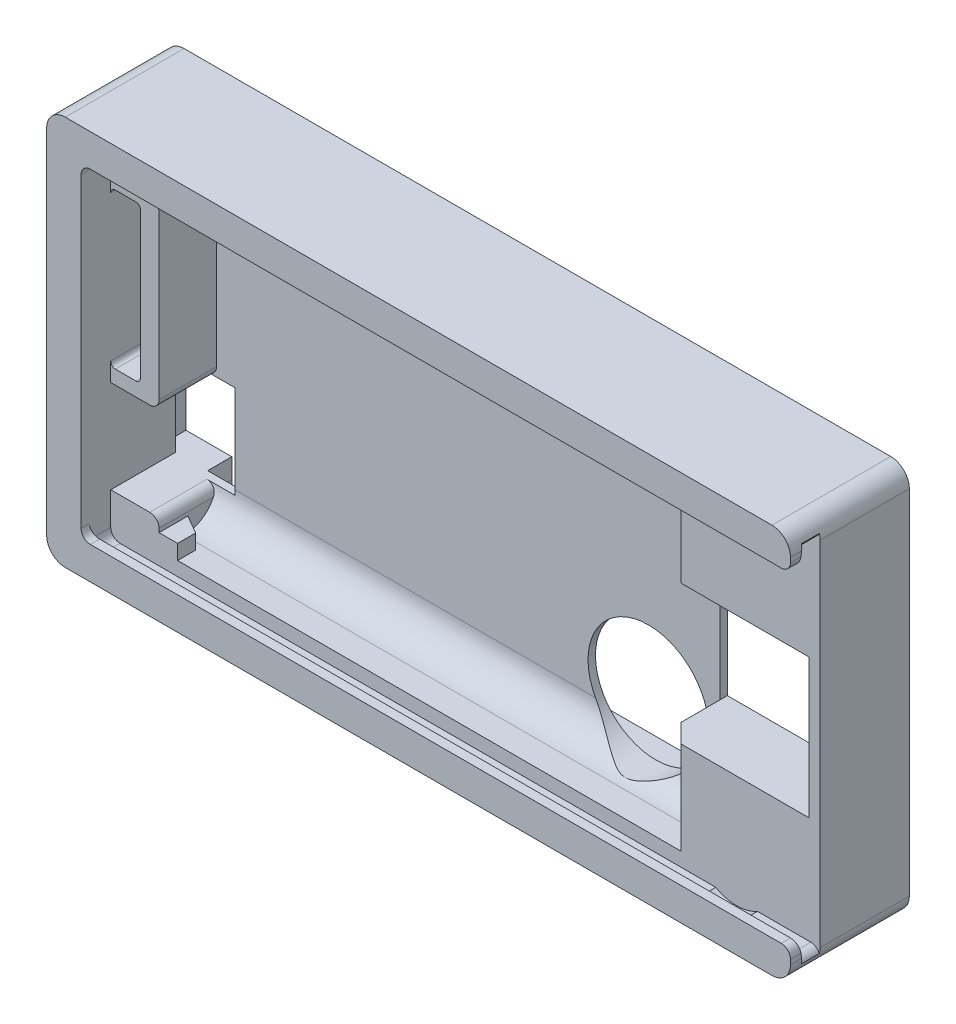
from build123d import *

# Parameters (mm, degrees)
SKETCH2_W                 = 76.4
SKETCH2_H                 = 38
BOSS_EXTRUDE1_DEPTH       = 7
CUT_BATTERY_DEPTH         = 27.1
SKETCH4_W                 = 13.8
SKETCH4_H                 = 15
CUT_FOR_FINGER_DEPTH      = 49.526384576
CHAMFER3_SIZE2            = 7
CHAMFER3_SIZE             = 2
SKETCH5_W                 = 2
SKETCH5_H                 = 3.1
BOSS_EXTRUDE2_DEPTH       = 1.6
CHAMFER1_SIZE2            = 2
CHAMFER1_SIZE             = 1.154700538
CHAMFER1_OF_MIRROR1_SIZE2 = 1.154700538
CHAMFER1_OF_MIRROR1_SIZE  = 2
SKETCH6_W                 = 7.2
SKETCH6_H                 = 10
CUT_CONNECTOR_DEPTH       = 49.526384576
BOSS_EXTRUDE3_DEPTH       = 10.2
SKETCH10_R                = 4.5
CUT_LATCH_DEPTH           = 2
BOSS_EXTRUDE4_REACH       = 83.802
FILLET3_R                 = 1
CHAMFER2_SIZE             = 2
FILLET2_R                 = 1
SKETCH12_W                = 3.2
SKETCH12_H                = 16.7
CUT_EXTRUDE6_DEPTH        = 50.343793936
FILLET1_R                 = 0.5
SKETCH13_W                = 1.7
SKETCH13_H                = 42
BOSS_EXTRUDE5_DEPTH       = 10.2
SKETCH16_R                = 1.1
CUT_EXTRUDE7_DEPTH        = 3
PCB_START                 = 2.6
SKETCH18_W                = 75.7
SKETCH18_H                = 37.5
SKETCH18_R                = 1.1
PCB_STAND_DEPTH           = 2.6
SKETCH19_W                = 1
SKETCH19_H                = 10
CUT_EXTRUDE8_DEPTH        = 2.6
F_2_0MM_DOWEL_HOLE1_D     = 2.2
F_2_0MM_DOWEL_HOLE1_DEPTH = 7.5
F_2_0MM_DOWEL_HOLE1_TIP   = 1.905255888
SKETCH22_W                = 80.1
SKETCH22_H                = 42
SKETCH22_W_2              = 75.7
SKETCH22_H_2              = 37.5
BOSS_EXTRUDE8_DEPTH       = 2.6
FILLET4_R                 = 2
FILLET5_R                 = 1
FILLET6_R                 = 1
FILLET7_R                 = 1
SKETCH23_W                = 13
SKETCH23_H                = 4.2
CUT_CAPACITOR_DEPTH       = 3
FILLET8_R                 = 2.2
MOTOR_START               = -5.886343
SKETCH24_R                = 6.5
MOTOR_DEPTH               = 3.286343


# Some blends are built 0.0001 mm under size
with BuildPart() as part:
    # Sketch2 → Boss-Extrude1 (new body)
    with BuildSketch(Plane.XY):
        with Locations((5.9, 0)):
            Rectangle(SKETCH2_W, SKETCH2_H)
    extrude(amount=BOSS_EXTRUDE1_DEPTH)

    # Sketch3 → Cut-Battery (cut, symmetric)
    with BuildSketch(Plane(origin=(0, 0, 0), x_dir=(0, 0, -1), z_dir=(1, 0, 0))):
        with BuildLine():
            Line((-7.8, 17.5), (-4.3, 17.5))
            ThreePointArc((-4.3, 17.5), (-1.825126266, 16.474873734), (-0.8, 14))
            Line((-0.8, 14), (-0.8, -14))
            ThreePointArc((-0.8, -14), (-1.825126266, -16.474873734), (-4.3, -17.5))
            Line((-4.3, -17.5), (-7.8, -17.5))
            Line((-7.8, -17.5), (-7.8, 17.5))
        make_face()
    extrude(amount=CUT_BATTERY_DEPTH, both=True, mode=Mode.SUBTRACT)

    # Sketch4 → Cut for finger (cut, through all)
    with BuildSketch(Plane.XY.offset(7)):
        with Locations((34, 0)):
            Rectangle(SKETCH4_W, SKETCH4_H)
    extrude(amount=-CUT_FOR_FINGER_DEPTH, mode=Mode.SUBTRACT)

    # Chamfer3
    chamfer3_edges = [part.edges().sort_by_distance(p)[0] for p in [
        (40.9, 0, 7),
    ]]
    chamfer3_side = [part.faces().sort_by_distance(p)[0] for p in [
        (40.94, 0, 7),
    ]]
    chamfer(chamfer3_edges, length=CHAMFER3_SIZE - 0.0001, length2=CHAMFER3_SIZE2 - 0.0001, reference=chamfer3_side[0])  # a hair under: the kernel refuses the full size

    # Sketch5 → Boss-Extrude2 (add)
    with BuildSketch(Plane.XZ.offset(-17.5)):
        with Locations((-26.1, 5.45)):
            Rectangle(SKETCH5_W, SKETCH5_H)
    boss_extrude2 = extrude(amount=BOSS_EXTRUDE2_DEPTH)

    # Chamfer1
    chamfer1_edges = [part.edges().sort_by_distance(p)[0] for p in [
        (-25.1, 16.688533865, 3.9),
    ]]
    chamfer1_side = [part.faces().sort_by_distance(p)[0] for p in [
        (-25.1, 16.688533865, 3.923094011),
    ]]
    chamfer(chamfer1_edges, length=CHAMFER1_SIZE - 0.0001, length2=CHAMFER1_SIZE2 - 0.0001, reference=chamfer1_side[0])  # a hair under: the kernel refuses the full size

    # Mirror1: Boss-Extrude2 across plane
    add(boss_extrude2.mirror(Plane.ZX))

    # Chamfer1 of Mirror1
    chamfer1_of_mirror1_edges = [part.edges().sort_by_distance(p)[0] for p in [
        (-25.1, -16.688533865, 3.9),
    ]]
    chamfer1_of_mirror1_side = [part.faces().sort_by_distance(p)[0] for p in [
        (-25.123094011, -16.688533865, 3.9),
    ]]
    chamfer(chamfer1_of_mirror1_edges, length=CHAMFER1_OF_MIRROR1_SIZE - 0.0001, length2=CHAMFER1_OF_MIRROR1_SIZE2 - 0.0001, reference=chamfer1_of_mirror1_side[0])  # a hair under: the kernel refuses the full size

    # Sketch6 → Cut-Connector (cut, through all)
    with BuildSketch(Plane.XY.offset(7)):
        with Locations((-28.7, -9.5)):
            Rectangle(SKETCH6_W, SKETCH6_H)
    extrude(amount=-CUT_CONNECTOR_DEPTH, mode=Mode.SUBTRACT)

    # Sketch9 → Boss-Extrude3 (add)
    with BuildSketch(Plane.XY):
        Polygon((44.1, -19), (-32.3, -19), (-32.3, 19), (44.1, 19), (44.1, 21), (-34.3, 21), (-34.3, -21), (44.1, -21), align=None)
    extrude(amount=BOSS_EXTRUDE3_DEPTH)

    # Sketch10 → Cut-Latch (cut)
    with BuildSketch(Plane.XY.offset(7)):
        with Locations((35.1, 15.1)):
            Circle(SKETCH10_R)
        with Locations((35.1, -15.1)):
            Circle(SKETCH10_R)
    extrude(amount=CUT_LATCH_DEPTH, mode=Mode.SUBTRACT)

    # Boss-Extrude4: up to this face of the body (flat: up to its plane)
    boss_extrude4_end = Plane(part.part.faces().sort_by_distance((-32.3, -16.75, 7.393451395))[0])
    # Sketch11 → Boss-Extrude4 (add, up to the picked face)
    with BuildSketch(Plane(origin=(44.1, 0, 0), x_dir=(0, 0, -1), z_dir=(1, 0, 0)), mode=Mode.PRIVATE) as boss_extrude4_sk1:
        Polygon((-10.2, 19), (-9, 19), (-9.2, 17.5), (-10.2, 17.5), align=None)
    boss_extrude4_tool1 = split(extrude(boss_extrude4_sk1.sketch, amount=-BOSS_EXTRUDE4_REACH, mode=Mode.PRIVATE), bisect_by=boss_extrude4_end, keep=Keep.BOTH, mode=Mode.PRIVATE)
    # Sketch11 → Boss-Extrude4 (add, up to the picked face)
    with BuildSketch(Plane(origin=(44.1, 0, 0), x_dir=(0, 0, -1), z_dir=(1, 0, 0)), mode=Mode.PRIVATE) as boss_extrude4_sk2:
        Polygon((-9.2, -17.5), (-10.2, -17.5), (-10.2, -19), (-9, -19), align=None)
    boss_extrude4_tool2 = split(extrude(boss_extrude4_sk2.sketch, amount=-BOSS_EXTRUDE4_REACH, mode=Mode.PRIVATE), bisect_by=boss_extrude4_end, keep=Keep.BOTH, mode=Mode.PRIVATE)
    add(boss_extrude4_tool1.solids().sort_by(Axis((44.1, 18.272727, 9.648485), (-1, 0, 0)))[0])
    add(boss_extrude4_tool2.solids().sort_by(Axis((44.1, -18.272727, 9.648485), (-1, 0, 0)))[0])

    # Fillet3
    fillet3_edges = [part.edges().sort_by_distance(p)[0] for p in [
        (44.1, 19, 8),
        (44.1, -19, 8),
    ]]
    fillet(fillet3_edges, radius=FILLET3_R)

    # Chamfer2
    chamfer2_edges = [part.edges().sort_by_distance(p)[0] for p in [
        (27.1, 12.5, 7),
        (27.1, -12.5, 7),
    ]]
    chamfer(chamfer2_edges, length=CHAMFER2_SIZE)

    # Fillet2
    fillet2_edges = [part.edges().sort_by_distance(p)[0] for p in [
        (-27.1, -4.5, 3.9),
        (-27.1, -14.5, 3.917949192),
    ]]
    fillet(fillet2_edges, radius=FILLET2_R)

    # Sketch12 → Cut-Extrude6 (cut, through all)
    with BuildSketch(Plane.XY.offset(7)):
        with Locations((-30.7, 5.35)):
            Rectangle(SKETCH12_W, SKETCH12_H)
    extrude(amount=-CUT_EXTRUDE6_DEPTH, mode=Mode.SUBTRACT)

    # Fillet1
    fillet1_edges = [part.edges().sort_by_distance(p)[0] for p in [
        (-32.3, -3, 3.5),
        (-32.3, 13.7, 3.5),
        (-29.1, 13.7, 3.5),
        (-29.1, -3, 3.5),
    ]]
    fillet(fillet1_edges, radius=FILLET1_R)

    # Sketch13 → Boss-Extrude5 (add)
    with BuildSketch(Plane(origin=(0, 0, 0), x_dir=(-1, 0, 0), z_dir=(0, 0, -1))):
        with Locations((35.15, 0)):
            Rectangle(SKETCH13_W, SKETCH13_H)
    extrude(amount=-BOSS_EXTRUDE5_DEPTH)

    # Sketch16 → Cut-Extrude7 (cut)
    with BuildSketch(Plane(origin=(0, 0, 0), x_dir=(-1, 0, 0), z_dir=(0, 0, -1))):
        with Locations((-39.55, 16.4)):
            Circle(SKETCH16_R)
        with Locations((31.45, 16.4)):
            Circle(SKETCH16_R)
        with Locations((31.45, -16.4)):
            Circle(SKETCH16_R)
        with Locations((-39.55, -16.4)):
            Circle(SKETCH16_R)
    extrude(amount=-CUT_EXTRUDE7_DEPTH, mode=Mode.SUBTRACT)

    # Sketch18 → PCB stand (add)
    with BuildSketch(Plane(origin=(0, 0, 0), x_dir=(-1, 0, 0), z_dir=(0, 0, -1)).offset(PCB_START)):
        with Locations((-4.05, 0)):
            Rectangle(SKETCH18_W, SKETCH18_H)
        with Locations((-39.55, 16.4)):
            Circle(SKETCH18_R, mode=Mode.SUBTRACT)
        with Locations(Location((-39.55, -16.4, 0), (0, 0, 180))):
            Circle(SKETCH18_R, mode=Mode.SUBTRACT)
        with Locations((31.45, -16.4)):
            Circle(SKETCH18_R, mode=Mode.SUBTRACT)
        with Locations(Location((31.45, 16.4, 0), (0, 0, 180))):
            Circle(SKETCH18_R, mode=Mode.SUBTRACT)
        with BuildLine():
            Line((-35.967054285, 17.75), (27.867054285, 17.75))
            ThreePointArc((27.867054285, 17.75), (28.607737153, 17.421854812), (28.862316983, 16.652777778))
            ThreePointArc((28.862316983, 16.652777778), (29.611522369, 14.561522369), (31.702777778, 13.812316983))
            ThreePointArc((31.702777778, 13.812316983), (32.471854812, 13.557737153), (32.8, 12.817054285))
            Line((32.8, 12.817054285), (32.8, -12.817054285))
            Line((32.8, -12.817054285), (32.8, -14.5))
            Line((32.8, -14.5), (28.862316983, -14.5))
            Line((28.862316983, -14.5), (28.862316983, -16.652777778))
            ThreePointArc((28.862316983, -16.652777778), (28.607737153, -17.421854812), (27.867054285, -17.75))
            Line((27.867054285, -17.75), (-35.967054285, -17.75))
            ThreePointArc((-35.967054285, -17.75), (-36.707737153, -17.421854812), (-36.962316983, -16.652777778))
            ThreePointArc((-36.962316983, -16.652777778), (-37.711522369, -14.561522369), (-39.802777778, -13.812316983))
            ThreePointArc((-39.802777778, -13.812316983), (-40.571854812, -13.557737153), (-40.9, -12.817054285))
            Line((-40.9, -12.817054285), (-40.9, 12.817054285))
            ThreePointArc((-40.9, 12.817054285), (-40.571854812, 13.557737153), (-39.802777778, 13.812316983))
            ThreePointArc((-39.802777778, 13.812316983), (-37.711522369, 14.561522369), (-36.962316983, 16.652777778))
            ThreePointArc((-36.962316983, 16.652777778), (-36.707737153, 17.421854812), (-35.967054285, 17.75))
        make_face(mode=Mode.SUBTRACT)
    extrude(amount=-PCB_STAND_DEPTH)

    # Sketch19 → Cut-Extrude8 (cut)
    with BuildSketch(Plane(origin=(0, 0, -2.6), x_dir=(-1, 0, 0), z_dir=(0, 0, -1))):
        with Locations((33.3, -9.5)):
            Rectangle(SKETCH19_W, SKETCH19_H)
    extrude(amount=-CUT_EXTRUDE8_DEPTH, mode=Mode.SUBTRACT)

    # Ø2.0mm Dowel Hole1
    with Locations(Plane(origin=(0, 0, -2.6), x_dir=(-1, 0, 0), z_dir=(0, 0, -1))):
        with Locations((-39.55, -16.4), (-39.55, 16.4), (31.45, 16.4), (31.45, -16.4)):
            Hole(F_2_0MM_DOWEL_HOLE1_D / 2, depth=F_2_0MM_DOWEL_HOLE1_DEPTH)
            with Locations((0, 0, -(F_2_0MM_DOWEL_HOLE1_DEPTH + F_2_0MM_DOWEL_HOLE1_TIP / 2))):  # 60° drill point
                Cone(0, F_2_0MM_DOWEL_HOLE1_D / 2, F_2_0MM_DOWEL_HOLE1_TIP, mode=Mode.SUBTRACT)

    # Sketch22 → Boss-Extrude8 (add)
    with BuildSketch(Plane(origin=(0, 0, 0), x_dir=(-1, 0, 0), z_dir=(0, 0, -1))):
        with Locations((-4.05, 0)):
            Rectangle(SKETCH22_W, SKETCH22_H)
        with Locations((-4.05, 0)):
            Rectangle(SKETCH22_W_2, SKETCH22_H_2, mode=Mode.SUBTRACT)
    extrude(amount=BOSS_EXTRUDE8_DEPTH)

    # Fillet4
    # the kernel refuses this fillet: 2 mm, written as the material it takes off along each edge
    with BuildSketch(Plane(origin=(44.1, 21, -7.6), x_dir=(-1, 0, 0), z_dir=(0, 0, 1)), Plane(origin=(44.1, -21, 15.2), x_dir=(-1, 0, 0), z_dir=(0, 0, -1)), Plane(origin=(-36, -21, 15.2), x_dir=(0, 1, 0), z_dir=(0, 0, -1)), Plane(origin=(-36, 21, -7.6), x_dir=(0, -1, 0), z_dir=(0, 0, 1))) as fillet4_piece_1:
        with BuildLine():
            CenterArc((FILLET4_R, FILLET4_R), FILLET4_R, 180, 90)
            Line((0, FILLET4_R), (-FILLET4_R * 0.02, FILLET4_R))
            Line((-FILLET4_R * 0.02, FILLET4_R), (-FILLET4_R * 0.02, -FILLET4_R * 0.02))
            Line((-FILLET4_R * 0.02, -FILLET4_R * 0.02), (FILLET4_R, -FILLET4_R * 0.02))
            Line((FILLET4_R, -FILLET4_R * 0.02), (FILLET4_R, 0))
        make_face()
    extrude(amount=22.8, mode=Mode.SUBTRACT)

    # Fillet5
    fillet5_edges = [part.edges().sort_by_distance(p)[0] for p in [
        (44.1, 17.5, 9.7),
        (44.1, -17.5, 9.7),
    ]]
    fillet(fillet5_edges, radius=FILLET5_R)

    # Fillet6
    fillet6_edges = [part.edges().sort_by_distance(p)[0] for p in [
        (-32.3, 17.5, 9.7),
        (-32.3, -17.5, 9.7),
    ]]
    fillet(fillet6_edges, radius=FILLET6_R)

    # Fillet7
    fillet7_edges = [part.edges().sort_by_distance(p)[0] for p in [
        (-32.3, 19, 8),
        (-32.3, -19, 8),
    ]]
    fillet(fillet7_edges, radius=FILLET7_R)

    # Sketch23 → Cut-Capacitor (cut)
    with BuildSketch(Plane(origin=(0, 0, -2.6), x_dir=(-1, 0, 0), z_dir=(0, 0, -1))):
        with Locations((15, -16.65)):
            Rectangle(SKETCH23_W, SKETCH23_H)
    extrude(amount=-CUT_CAPACITOR_DEPTH, mode=Mode.SUBTRACT)

    # Fillet8
    fillet8_edges = [part.edges().sort_by_distance(p)[0] for p in [
        (-15, -18.75, 0.4),
    ]]
    fillet(fillet8_edges, radius=FILLET8_R)

    # Sketch24 → Motor (cut)
    with BuildSketch(Plane(origin=(0, 0, -2.6), x_dir=(-1, 0, 0), z_dir=(0, 0, -1)).offset(MOTOR_START)):
        with Locations(Location((-19.4, -10.85, 0), (0, 0, 331.012723469))):
            Circle(SKETCH24_R)
    extrude(amount=MOTOR_DEPTH, mode=Mode.SUBTRACT)


solid = part.part
